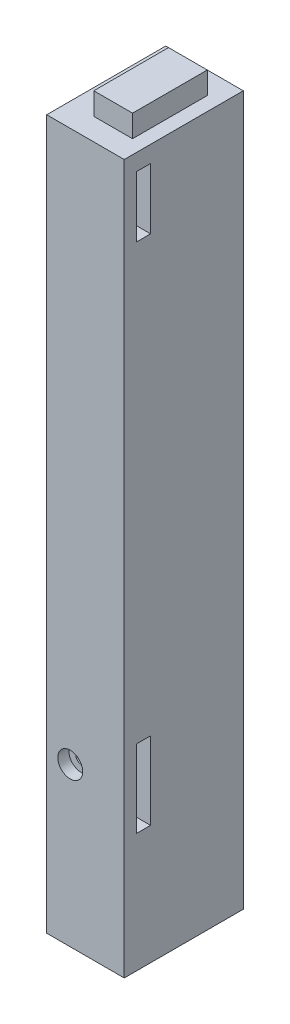
from build123d import *

# Parameters (mm, degrees)
SKETCH1_W           = 88.9
SKETCH1_H           = 812.8
BOSS_EXTRUDE1_DEPTH = 136.525
SKETCH2_W           = 44.45
SKETCH2_H           = 85.725
BOSS_EXTRUDE2_DEPTH = 25.4
SKETCH4_W           = 15.875
SKETCH4_H           = 88.9
SKETCH4_H_2         = 69.85
CUT_EXTRUDE1_DEPTH  = 50.8
SKETCH5_W           = 25.4
SKETCH5_H           = 82.55
CUT_EXTRUDE2_DEPTH  = 50.8
SKETCH6_R           = 14.2875
CUT_EXTRUDE3_DEPTH  = 12.7
SKETCH7_R           = 6.35
CUT_EXTRUDE4_DEPTH  = 452.397466901


with BuildPart() as part:
    # Sketch1 → Boss-Extrude1 (new body)
    with BuildSketch(Plane.XY):
        Rectangle(SKETCH1_W, SKETCH1_H)
    extrude(amount=BOSS_EXTRUDE1_DEPTH)

    # Sketch2 → Boss-Extrude2 (add)
    with BuildSketch(Plane(origin=(0, 406.4, 0), x_dir=(1, 0, 0), z_dir=(0, 1, 0))):
        with Locations((6.35, -68.2625)):
            Rectangle(SKETCH2_W, SKETCH2_H)
    extrude(amount=BOSS_EXTRUDE2_DEPTH)

    # Sketch4 → Cut-Extrude1 (cut)
    with BuildSketch(Plane(origin=(44.45, 0, 0), x_dir=(0, 0, -1), z_dir=(1, 0, 0))):
        with Locations((-114.3, -225.425)):
            Rectangle(SKETCH4_W, SKETCH4_H)
        with Locations((-114.3, 352.425)):
            Rectangle(SKETCH4_W, SKETCH4_H_2)
    extrude(amount=-CUT_EXTRUDE1_DEPTH, mode=Mode.SUBTRACT)

    # Sketch5 → Cut-Extrude2 (cut)
    with BuildSketch(Plane(origin=(0, 0, 0), x_dir=(-1, 0, 0), z_dir=(0, 0, -1))):
        with Locations((17.4625, -225.425)):
            Rectangle(SKETCH5_W, SKETCH5_H)
    extrude(amount=-CUT_EXTRUDE2_DEPTH, mode=Mode.SUBTRACT)

    # Sketch6 → Cut-Extrude3 (cut)
    with BuildSketch(Plane.XY.offset(136.525)):
        with Locations((-17.4625, -225.425)):
            Circle(SKETCH6_R)
    extrude(amount=-CUT_EXTRUDE3_DEPTH, mode=Mode.SUBTRACT)

    # Sketch7 → Cut-Extrude4 (cut, through all)
    with BuildSketch(Plane.XY.offset(123.825)):
        with Locations((-17.4625, -225.425)):
            Circle(SKETCH7_R)
    extrude(amount=-CUT_EXTRUDE4_DEPTH, mode=Mode.SUBTRACT)


solid = part.part
